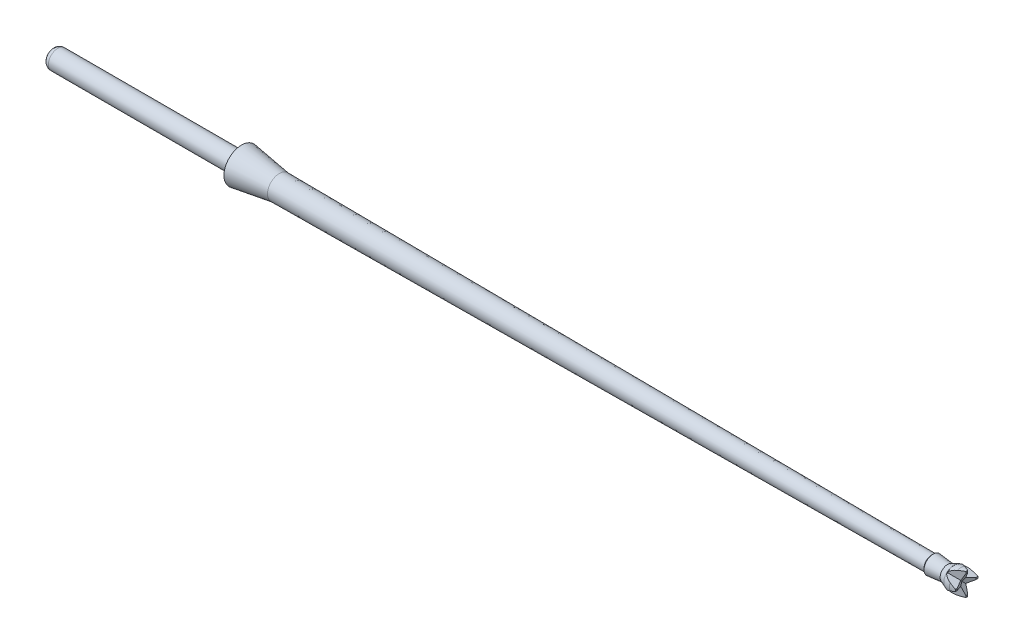
from build123d import *

# Parameters (mm, degrees)
FILLET1_R               = 2
CUT_EXTRUDE1_DEPTH      = 77.644667233
CUT_EXTRUDE2_DEPTH      = 77.644667233
CUT_EXTRUDE2_DEPTH_BACK = 77.644667233
BODY_MOVE_COPY1_ANGLE   = 90
FILLET2_R               = 0.6


with BuildPart() as part:
    # Sketch1 → Revolve1 (revolve)
    with BuildSketch(Plane.XY):
        Polygon((0, 1), (0, 1.85), (4, 1.25), (72.9, 0.8), (73.05, 0.95), (74.6, 0.8), (75.6, 1.2), (76.6, 1.2), (76.6, 0), (0, 0), (-20, 0), (-20, 1), align=None)
    revolve(axis=Axis((76.6, 0, 0), (-1, 0, 0)))

    # Fillet1
    fillet1_edges = [part.edges().sort_by_distance(p)[0] for p in [
        (75.6, -1.2, 0),
    ]]
    fillet(fillet1_edges, radius=FILLET1_R)

    # Sketch2 → Cut-Extrude1 (cut, symmetric)
    with BuildSketch(Plane.XY):
        Polygon((76.6, 0.1), (75.3, 0.697004061), (75.3, 1.3), (76.6, 1.3), align=None)
    cut_extrude1 = extrude(amount=CUT_EXTRUDE1_DEPTH, both=True, mode=Mode.SUBTRACT)

    # Mirror1: Cut-Extrude1 across plane
    add(cut_extrude1.mirror(Plane.ZX), mode=Mode.SUBTRACT)

    # Sketch3 → Cut-Extrude2 (cut, two sides: drawn at the far end of the back side and taken through both)
    with BuildSketch(Plane(origin=(0, 0, 0), x_dir=(1, 0, 0), z_dir=(0, 1, 0)).offset(-CUT_EXTRUDE2_DEPTH_BACK)):
        Polygon((76.6, 1), (76.6, -1), (76.1, 0), align=None)
    extrude(amount=CUT_EXTRUDE2_DEPTH + CUT_EXTRUDE2_DEPTH_BACK, mode=Mode.SUBTRACT)


with BuildPart() as body_2:
    # Split1: the piece on the far side of the plane
    add(part.part)
    split(bisect_by=Plane(origin=(74.6, 0, 0), x_dir=(0, 0, 1), z_dir=(1, 0, 0)), keep=Keep.BOTTOM)


with BuildPart() as part_1:
    add(part.part)

    # Split1
    split(bisect_by=Plane(origin=(74.6, 0, 0), x_dir=(0, 0, 1), z_dir=(1, 0, 0)), keep=Keep.TOP)


with BuildPart() as body_3:
    # Body-Move/Copy1: copy of part
    add(part_1.part.rotate(Axis((0, 0, -0.015428444), (1, 0, 0)), BODY_MOVE_COPY1_ANGLE))


with BuildPart() as body_2_1:
    add(body_2.part)

    # Combine1: union body 3, part
    add(body_3.part)
    add(part_1.part)

    # Fillet2
    fillet2_edges = [body_2_1.edges().sort_by_distance(p)[0] for p in [
        (-20, -1, 0),
    ]]
    fillet(fillet2_edges, radius=FILLET2_R)


solid = body_2_1.part
